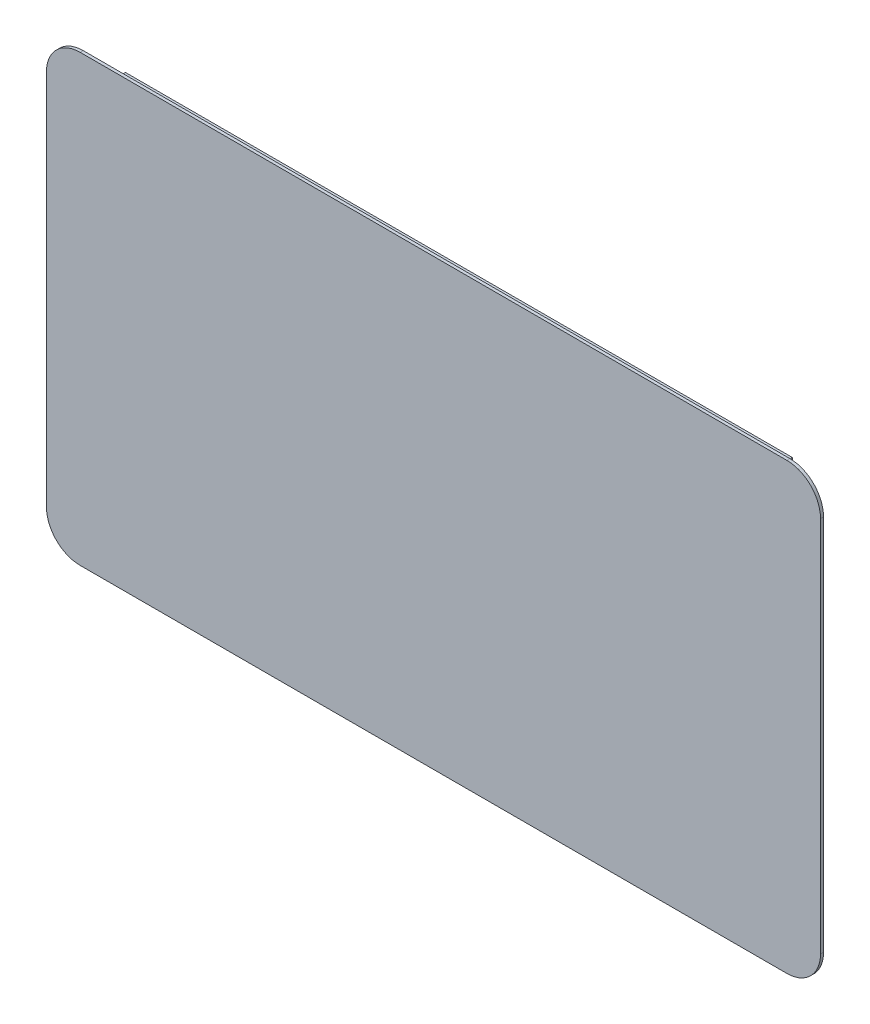
from build123d import *

# Parameters (mm, degrees)
SKETCH_1_W          = 193
SKETCH_1_H          = 110.8
EXTRUDE_1_DEPTH     = 0.75
FILLET_1_R          = 8.4
SKETCH_2_W          = 166.3
SKETCH_2_H          = 100.7
EXTRUDE_2_DEPTH     = 5.6
SKETCH_3_W          = 6
SKETCH_3_H          = 8
EXTRUDE_3_DEPTH     = 2.34
CHAMFER_1_SIZE      = 2.34
SKETCH_4_R          = 1.35
CUT_EXTRUDE_1_DEPTH = 2.34
SKETCH_5_W          = 7.8
SKETCH_5_H          = 7.8
EXTRUDE_4_DEPTH     = 2.34
SKETCH_6_W          = 65
SKETCH_6_H          = 56
EXTRUDE_5_DEPTH     = 1.2
FILLET_2_R          = 2.5
SKETCH_7_R          = 1.25
CUT_EXTRUDE_2_DEPTH = 0.6


with BuildPart() as part:
    # 草图1 → 凸台-拉伸1 (new body)
    with BuildSketch(Plane.XY):
        Rectangle(SKETCH_1_W, SKETCH_1_H)
    extrude(amount=EXTRUDE_1_DEPTH)

    # 圆角1
    fillet_1_edges = [part.edges().sort_by_distance(p)[0] for p in [
        (96.5, -55.4, 0.375),
        (-96.5, -55.4, 0.375),
        (-96.5, 55.4, 0.375),
        (96.5, 55.4, 0.375),
    ]]
    fillet(fillet_1_edges, radius=FILLET_1_R)

    # 草图2 → 凸台-拉伸2 (add)
    with BuildSketch(Plane(origin=(0, 0, 0), x_dir=(-1, 0, 0), z_dir=(0, 0, -1))):
        Rectangle(SKETCH_2_W, SKETCH_2_H)
    extrude(amount=EXTRUDE_2_DEPTH)

    # 草图3 → 凸台-拉伸3 (add)
    with BuildSketch(Plane(origin=(0, 0, -5.6), x_dir=(-1, 0, 0), z_dir=(0, 0, -1))):
        with Locations((-63, 34.1)):
            Rectangle(SKETCH_3_W, SKETCH_3_H)
        with Locations((-63, -31.9)):
            Rectangle(SKETCH_3_W, SKETCH_3_H)
        with Locations((63, 34.1)):
            Rectangle(SKETCH_3_W, SKETCH_3_H)
        with Locations((63, -31.9)):
            Rectangle(SKETCH_3_W, SKETCH_3_H)
    extrude(amount=EXTRUDE_3_DEPTH)

    # 倒角1
    chamfer_1_edges = [part.edges().sort_by_distance(p)[0] for p in [
        (66, -31.9, -5.6),
        (60, -31.9, -5.6),
        (-66, -31.9, -5.6),
        (-60, -31.9, -5.6),
        (-60, 34.1, -5.6),
        (-66, 34.1, -5.6),
        (60, 34.1, -5.6),
        (66, 34.1, -5.6),
    ]]
    chamfer(chamfer_1_edges, length=CHAMFER_1_SIZE - 0.0001)  # a hair under: the kernel refuses the full size

    # 草图4 → 切除-拉伸1 (cut)
    with BuildSketch(Plane(origin=(0, 0, -7.94), x_dir=(-1, 0, 0), z_dir=(0, 0, -1))):
        with Locations((-63, 34.1)):
            Circle(SKETCH_4_R)
        with Locations((-63, -31.9)):
            Circle(SKETCH_4_R)
        with Locations((63, -31.9)):
            Circle(SKETCH_4_R)
        with Locations((63, 34.1)):
            Circle(SKETCH_4_R)
    extrude(amount=-CUT_EXTRUDE_1_DEPTH, mode=Mode.SUBTRACT)

    # 草图5 → 凸台-拉伸4 (add)
    with BuildSketch(Plane(origin=(0, 0, -5.6), x_dir=(-1, 0, 0), z_dir=(0, 0, -1))):
        with Locations((-35.8, 31.4)):
            Rectangle(SKETCH_5_W, SKETCH_5_H)
        with Locations((22.2, 31.4)):
            Rectangle(SKETCH_5_W, SKETCH_5_H)
        with Locations((-35.8, -17.6)):
            Rectangle(SKETCH_5_W, SKETCH_5_H)
        with Locations((22.2, -17.6)):
            Rectangle(SKETCH_5_W, SKETCH_5_H)
    extrude(amount=EXTRUDE_4_DEPTH)

    # 草图6 → 凸台-拉伸5 (add)
    with BuildSketch(Plane(origin=(0, 0, -7.94), x_dir=(-1, 0, 0), z_dir=(0, 0, -1))):
        with Locations((-6.9, 7)):
            Rectangle(SKETCH_6_W, SKETCH_6_H)
    extrude(amount=EXTRUDE_5_DEPTH)

    # 圆角2
    fillet_2_edges = [part.edges().sort_by_distance(p)[0] for p in [
        (-25.6, -21, -8.54),
        (-25.6, 35, -8.54),
        (39.4, 35, -8.54),
        (39.4, -21, -8.54),
    ]]
    fillet(fillet_2_edges, radius=FILLET_2_R)

    # 草图7 → 切除-拉伸2 (cut)
    with BuildSketch(Plane(origin=(0, 0, -9.14), x_dir=(-1, 0, 0), z_dir=(0, 0, -1))):
        with Locations((-35.8, 31.4)):
            Circle(SKETCH_7_R)
        with Locations((22.2, 31.4)):
            Circle(SKETCH_7_R)
        with Locations((-35.8, -17.6)):
            Circle(SKETCH_7_R)
        with Locations((22.2, -17.6)):
            Circle(SKETCH_7_R)
    extrude(amount=-CUT_EXTRUDE_2_DEPTH, mode=Mode.SUBTRACT)


solid = part.part
